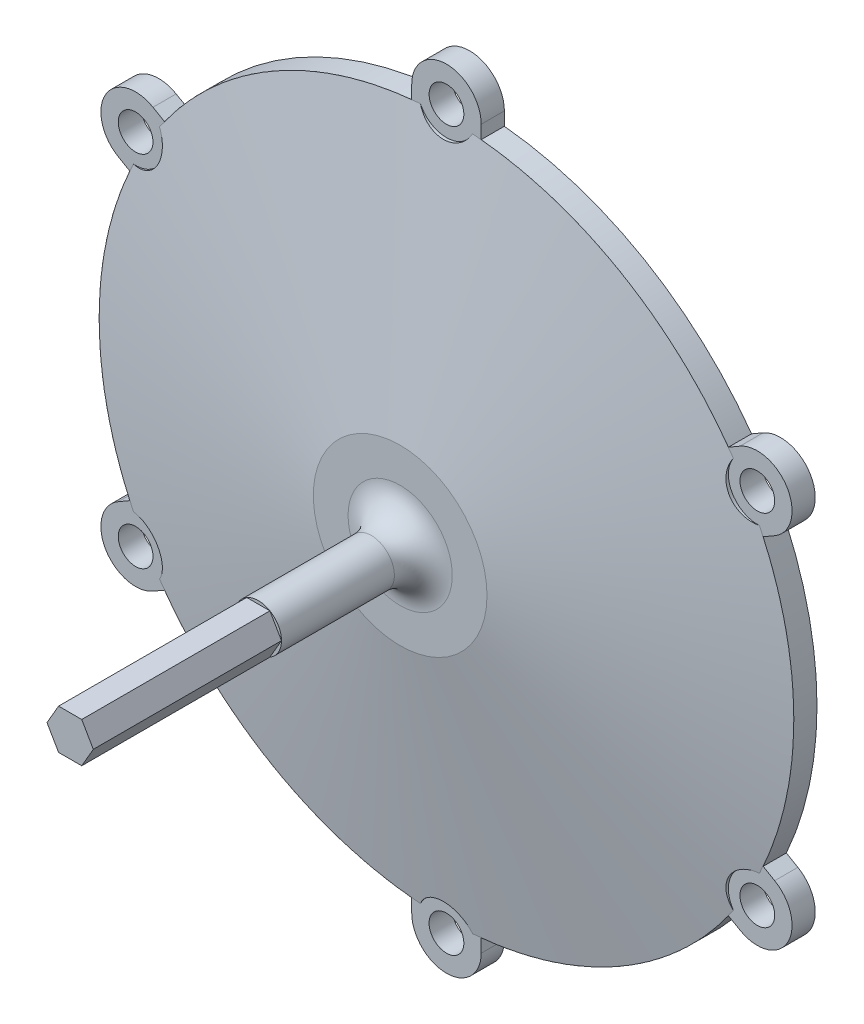
from build123d import *

# Parameters (mm, degrees)
SKETCH1_R           = 57
BOSS_EXTRUDE1_DEPTH = 4
SKETCH4_R           = 14
CUT_EXTRUDE1_DEPTH  = 7
SKETCH9_R           = 11.5
CUT_EXTRUDE4_DEPTH  = 0.5
SKETCH10_R          = 4
BOSS_EXTRUDE2_DEPTH = 57
FILLET1_R           = 5
SKETCH7_R           = 3
CUT_EXTRUDE2_DEPTH  = 112.575086825
SKETCH8_R           = 5
CUT_EXTRUDE3_DEPTH  = 112.575086825
CIRPATTERN6_COUNT   = 6
CUT_EXTRUDE5_DEPTH  = 32.5


with BuildPart() as part:
    # Sketch1 → Boss-Extrude1 (new body)
    with BuildSketch(Plane.XY):
        with BuildLine():
            ThreePointArc((6, 62), (0, 68), (-6, 62))
            Line((-6, 62), (-6, 59.699246226))
            ThreePointArc((-6, 59.699246226), (-30, 51.961524227), (-48.701063819, 35.045775536))
            Line((-48.701063819, 35.045775536), (-50.693575035, 36.196152423))
            ThreePointArc((-50.693575035, 36.196152423), (-58.889727457, 34), (-56.693575035, 25.803847577))
            Line((-56.693575035, 25.803847577), (-54.701063819, 24.65347069))
            ThreePointArc((-54.701063819, 24.65347069), (-60, 0), (-54.701063819, -24.65347069))
            Line((-54.701063819, -24.65347069), (-56.693575035, -25.803847577))
            ThreePointArc((-56.693575035, -25.803847577), (-58.889727457, -34), (-50.693575035, -36.196152423))
            Line((-50.693575035, -36.196152423), (-48.701063819, -35.045775536))
            ThreePointArc((-48.701063819, -35.045775536), (-30, -51.961524227), (-6, -59.699246226))
            Line((-6, -59.699246226), (-6, -62))
            ThreePointArc((-6, -62), (0, -68), (6, -62))
            Line((6, -62), (6, -59.699246226))
            ThreePointArc((6, -59.699246226), (30, -51.961524227), (48.701063819, -35.045775536))
            Line((48.701063819, -35.045775536), (50.693575035, -36.196152423))
            ThreePointArc((50.693575035, -36.196152423), (58.889727457, -34), (56.693575035, -25.803847577))
            Line((56.693575035, -25.803847577), (54.701063819, -24.65347069))
            ThreePointArc((54.701063819, -24.65347069), (60, 0), (54.701063819, 24.65347069))
            Line((54.701063819, 24.65347069), (56.693575035, 25.803847577))
            ThreePointArc((56.693575035, 25.803847577), (58.889727457, 34), (50.693575035, 36.196152423))
            Line((50.693575035, 36.196152423), (48.701063819, 35.045775536))
            ThreePointArc((48.701063819, 35.045775536), (30, 51.961524227), (6, 59.699246226))
            Line((6, 59.699246226), (6, 62))
        make_face()
        Circle(SKETCH1_R, mode=Mode.SUBTRACT)
    extrude(amount=BOSS_EXTRUDE1_DEPTH)

    # Sketch7 → Cut-Extrude2 (cut, through all)
    with BuildSketch(Plane.XY.offset(4)):
        with Locations((0, 62)):
            Circle(SKETCH7_R)
    cut_extrude2 = extrude(amount=-CUT_EXTRUDE2_DEPTH, mode=Mode.SUBTRACT)


with BuildPart() as body_2:
    # Sketch3 → Revolve1 (revolve)
    with BuildSketch(Plane(origin=(0, 0, 0), x_dir=(1, 0, 0), z_dir=(0, 1, 0))):
        Polygon((0, -0.5), (0, -12), (15, -12), (60, -4), (57, -4), (57, -0.5), align=None)
    revolve(axis=Axis((0, 0, 12), (0, 0, -1)))

    # Sketch4 → Cut-Extrude1 (cut)
    with BuildSketch(Plane.XY.offset(0.5)):
        Circle(SKETCH4_R)
    extrude(amount=CUT_EXTRUDE1_DEPTH, mode=Mode.SUBTRACT)

    # Sketch9 → Cut-Extrude4 (cut)
    with BuildSketch(Plane(origin=(0, 0, 7.5), x_dir=(-1, 0, 0), z_dir=(0, 0, -1))):
        Circle(SKETCH9_R)
    extrude(amount=-CUT_EXTRUDE4_DEPTH, mode=Mode.SUBTRACT)

    # Sketch10 → Boss-Extrude2 (add)
    with BuildSketch(Plane.XY.offset(12)):
        Circle(SKETCH10_R)
    extrude(amount=BOSS_EXTRUDE2_DEPTH)

    # Fillet1
    fillet1_edges = [body_2.edges().sort_by_distance(p)[0] for p in [
        (-4, 0, 12),
    ]]
    fillet(fillet1_edges, radius=FILLET1_R)

    # Sketch8 → Cut-Extrude3 (cut, through all)
    with BuildSketch(Plane.XY.offset(4)):
        with Locations((0, 62)):
            Circle(SKETCH8_R)
    cut_extrude3 = extrude(amount=CUT_EXTRUDE3_DEPTH, mode=Mode.SUBTRACT)


with BuildPart() as cirpattern6_tool:
    # CirPattern6: Cut-Extrude2, Cut-Extrude3 ×6 about axis
    cirpattern6_axis = Axis((0, 0, 4), (0, 0, 1))
    add([cut_extrude2.rotate(cirpattern6_axis, i * 360 / CIRPATTERN6_COUNT) for i in range(1, CIRPATTERN6_COUNT)])
    add([cut_extrude3.rotate(cirpattern6_axis, i * 360 / CIRPATTERN6_COUNT) for i in range(1, CIRPATTERN6_COUNT)])


with BuildPart() as part_1:
    add(part.part)

    # CirPattern6: cut by cirpattern6_tool
    add(cirpattern6_tool.part, mode=Mode.SUBTRACT)


with BuildPart() as body_2_1:
    add(body_2.part)

    # CirPattern6: cut by cirpattern6_tool
    add(cirpattern6_tool.part, mode=Mode.SUBTRACT)

    # Sketch11 → Cut-Extrude5 (cut)
    with BuildSketch(Plane.XY.offset(69)):
        with BuildLine():
            ThreePointArc((4, 0), (3.464101615, 2), (2, 3.464101615))
            Line((2, 3.464101615), (4, 0))
        make_face()
        with BuildLine():
            Line((-2, 3.464101615), (2, 3.464101615))
            ThreePointArc((2, 3.464101615), (0, 4), (-2, 3.464101615))
        make_face()
        with BuildLine():
            Line((-4, 0), (-2, 3.464101615))
            ThreePointArc((-2, 3.464101615), (-3.464101615, 2), (-4, 0))
        make_face()
        with BuildLine():
            ThreePointArc((2, -3.464101615), (3.464101615, -2), (4, 0))
            Line((4, 0), (2, -3.464101615))
        make_face()
        with BuildLine():
            Line((-2, -3.464101615), (-4, 0))
            ThreePointArc((-4, 0), (-3.464101615, -2), (-2, -3.464101615))
        make_face()
        with BuildLine():
            ThreePointArc((-2, -3.464101615), (0, -4), (2, -3.464101615))
            Line((2, -3.464101615), (-2, -3.464101615))
        make_face()
    extrude(amount=-CUT_EXTRUDE5_DEPTH, mode=Mode.SUBTRACT)


solid = Compound([part_1.part, body_2_1.part])
